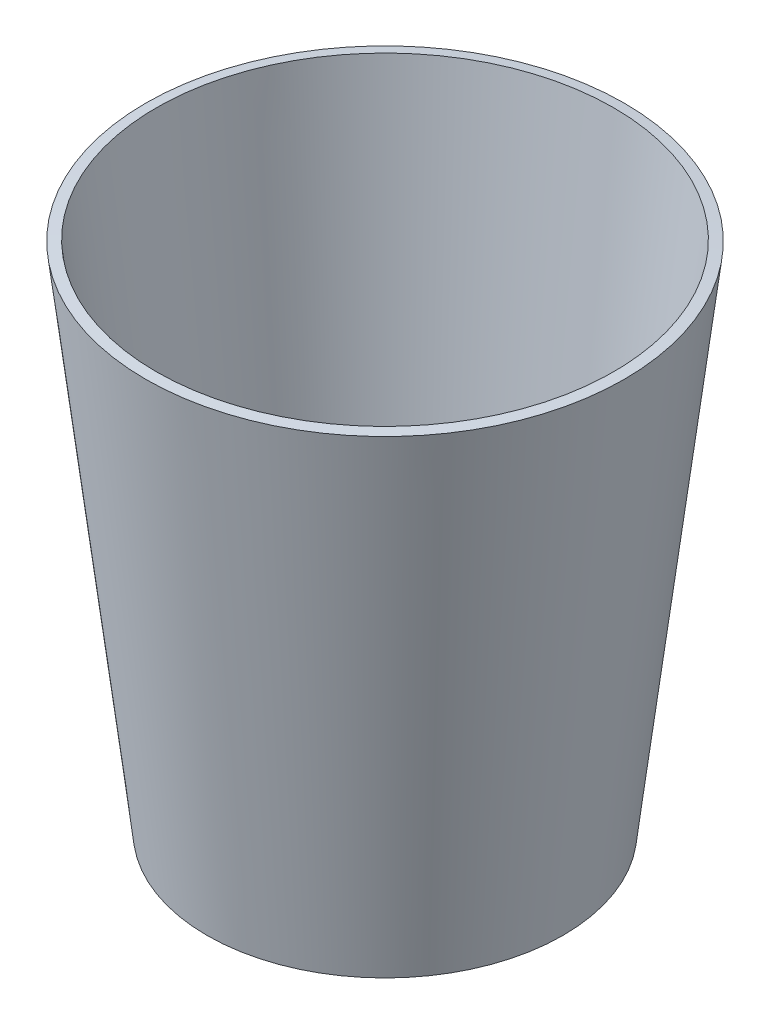
from build123d import *


# Read off the part's stored shape, not the designer's step: Thicken1
with BuildPart() as part:
    # Thicken1 outline → Thicken1 (revolve)
    with BuildSketch(Plane.XY):
        Polygon((43.000126639, 96.3), (31.5, 0), (33.485889655, -0.237154543), (44.986016294, 96.062845457), align=None)
    revolve(axis=Axis((0, 0, 0), (0, 1, 0)))


solid = part.part
